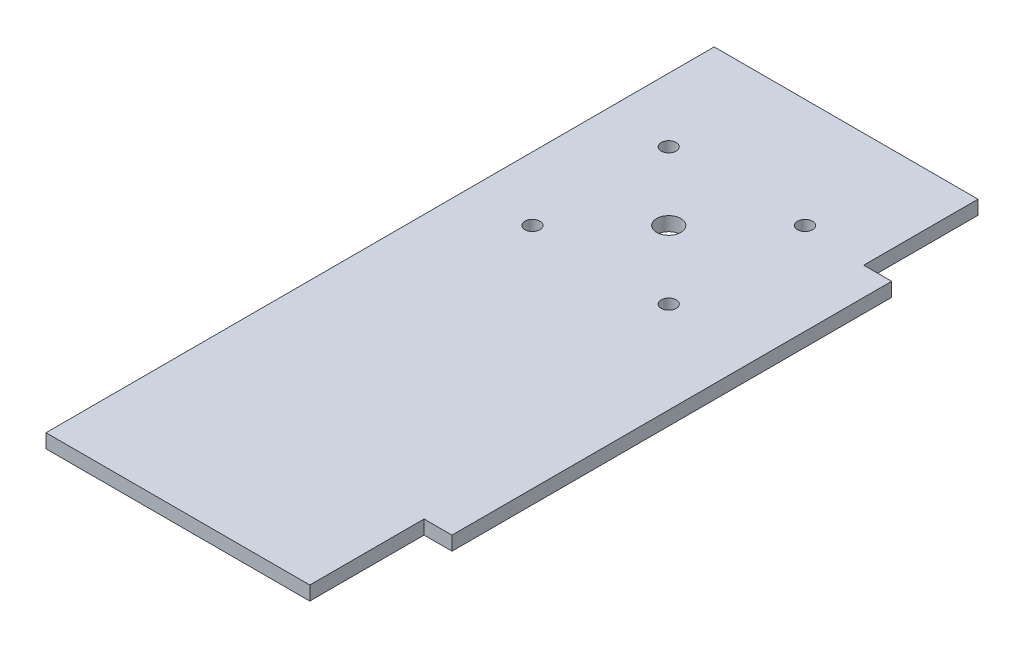
from build123d import *

# Parameters (mm, degrees)
BOSS_EXTRUDE1_DEPTH  = 3.175
SKETCH2_R            = 2.75
CUT_EXTRUDE1_DEPTH   = 132.176991599
M3_CLEARANCE_HOLE1_D = 3.4


with BuildPart() as part:
    # Sketch1 → Boss-Extrude1 (new body)
    with BuildSketch(Plane(origin=(0, 0, 0), x_dir=(1, 0, 0), z_dir=(0, 1, 0))):
        Polygon((30, 26), (-30, 26), (-30, 0), (-30, -100), (-30, -126), (30, -126), (30, -100), (36.35, -100), (36.35, 0), (30, 0), align=None)
    extrude(amount=BOSS_EXTRUDE1_DEPTH)

    # Sketch2 → Cut-Extrude1 (cut, through all)
    with BuildSketch(Plane(origin=(0, 3.175, 0), x_dir=(1, 0, 0), z_dir=(0, 1, 0))):
        with Locations((0, -14.35)):
            Circle(SKETCH2_R)
    extrude(amount=-CUT_EXTRUDE1_DEPTH, mode=Mode.SUBTRACT)

    # M3 Clearance Hole1 (through all)
    with Locations(Plane(origin=(0, 3.175, 0), x_dir=(1, 0, 0), z_dir=(0, 1, 0))):
        with Locations((-15.5, 1.15), (15.5, 1.15), (15.5, -29.85), (-15.5, -29.85)):
            Hole(M3_CLEARANCE_HOLE1_D / 2)


solid = part.part
